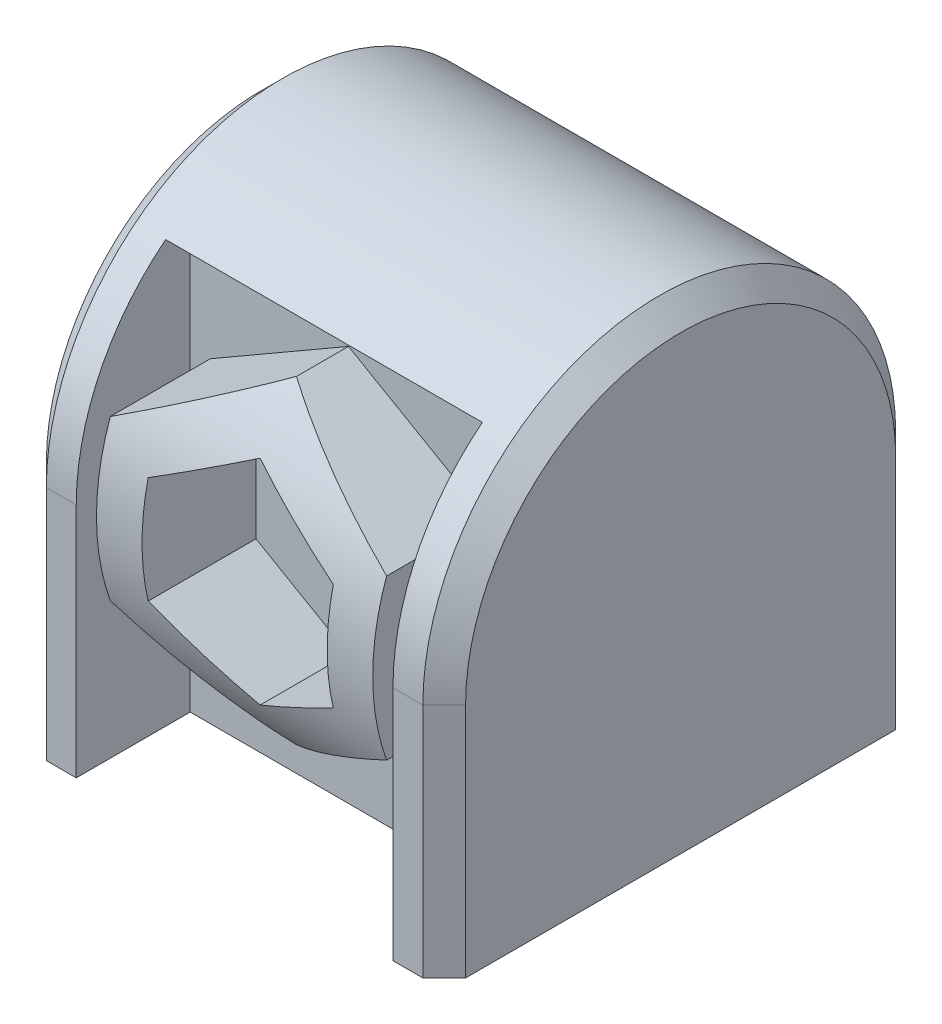
from build123d import *

# Parameters (mm, degrees)
BOSS_EXTRUDE1_DEPTH      = 18.6944
CHAMFER1_SIZE            = 0.9525
SKETCH2_W                = 14.1224
SKETCH2_H                = 18.796
CUT_EXTRUDE1_DEPTH       = 6.35
SHELL2_START             = 2.286
SHELL2_DEPTH             = 14.1224
BOSS_EXTRUDE3_REACH      = 28.031
BOSS_EXTRUDE3_END_RADIUS = 10.541
BOSS_EXTRUDE4_DEPTH      = 1.27
BOSS_EXTRUDE4_DEPTH_BACK = 0.9525
SKETCH4_W                = 14.473113765
SKETCH4_H                = 19.407327032


# Read off the part's stored shape, not the designer's step: Shell2
with BuildPart() as part:
    # Sketch1 → Boss-Extrude1 (new body)
    with BuildSketch(Plane(origin=(0, 0, 0), x_dir=(0, 0, -1), z_dir=(1, 0, 0))):
        with BuildLine():
            Line((-10.541, 0), (-10.541, -10.541))
            Line((-10.541, -10.541), (10.541, -10.541))
            Line((10.541, -10.541), (10.541, 0))
            ThreePointArc((10.541, 0), (0, 10.541), (-10.541, 0))
        make_face()
    extrude(amount=BOSS_EXTRUDE1_DEPTH)

    # Chamfer1
    chamfer1_edges = [part.edges().sort_by_distance(p)[0] for p in [
        (18.6944, -5.2705, 10.541),
        (18.6944, -5.2705, -10.541),
        (0, -5.2705, 10.541),
        (0, 10.541, 0),
        (0, -5.2705, -10.541),
        (18.6944, 10.541, 0),
    ]]
    chamfer(chamfer1_edges, length=CHAMFER1_SIZE)

    # Sketch2 → Cut-Extrude1 (cut)
    with BuildSketch(Plane.XY.offset(10.541)):
        with Locations((9.3472, -1.143)):
            Rectangle(SKETCH2_W, SKETCH2_H)
    extrude(amount=-CUT_EXTRUDE1_DEPTH, mode=Mode.SUBTRACT)

    # Shell2 outline → Shell2 (cut)
    with BuildSketch(Plane.YZ.offset(SHELL2_START)):
        with BuildLine():
            ThreePointArc((0, -8.255), (7.167347138, -4.095626936), (7.112, 4.191))
            Line((7.112, 4.191), (-8.255, 4.191))
            Line((-8.255, 4.191), (-8.255, -8.255))
            Line((-8.255, -8.255), (0, -8.255))
        make_face()
    extrude(amount=SHELL2_DEPTH, mode=Mode.SUBTRACT)



with BuildPart() as body_2:
    # Boss-Extrude3: up to this cylinder (the profile starts inside it)
    boss_extrude3_end = Plane(origin=(6.361697, 0, 0), z_dir=(-1, 0, 0)) * Cylinder(BOSS_EXTRUDE3_END_RADIUS, 78.144, mode=Mode.PRIVATE)
    # Sketch3 → Boss-Extrude3 (new, up to the surface)
    with BuildSketch(Plane.XY.offset(4.191), mode=Mode.PRIVATE) as boss_extrude3_sk1:
        Polygon((9.3472, 7.112), (3.188027328, 3.556), (3.188027328, -3.556), (9.3472, -7.112), (15.506372672, -3.556), (15.506372672, 3.556), align=None)
        Polygon((9.3472, 4.765648506), (5.220027328, 2.382824253), (5.220027328, -2.382824253), (9.3472, -4.765648506), (13.474372672, -2.382824253), (13.474372672, 2.382824253), align=None, mode=Mode.SUBTRACT)
    boss_extrude3_tool1 = extrude(boss_extrude3_sk1.sketch, amount=BOSS_EXTRUDE3_REACH, mode=Mode.PRIVATE) & boss_extrude3_end
    add(boss_extrude3_tool1.solids().sort_by_distance((6.361697, 5.171044, 4.191))[0])


with BuildPart() as part_1:
    add(part.part)

    add(body_2.part)  # Boss-Extrude4 merges body 2
    # Sketch4 → Boss-Extrude4 (add, two sides: drawn at the far end of the back side and taken through both)
    with BuildSketch(Plane.XY.offset(4.191).offset(-BOSS_EXTRUDE4_DEPTH_BACK)):
        with Locations((9.522556883, -0.837336484)):
            Rectangle(SKETCH4_W, SKETCH4_H)
    extrude(amount=BOSS_EXTRUDE4_DEPTH + BOSS_EXTRUDE4_DEPTH_BACK)


solid = part_1.part
